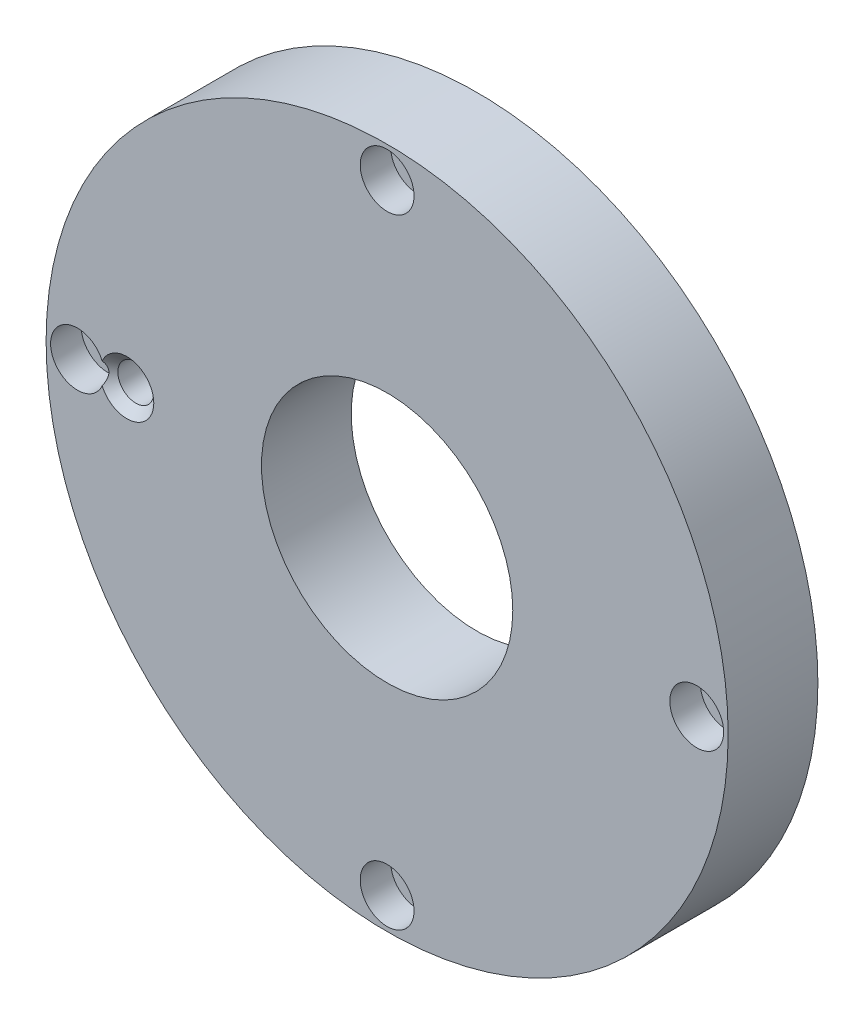
from build123d import *

# Parameters (mm, degrees)
SKETCH_1_R                = 38
SKETCH_1_R_2              = 14
EXTRUDE_1_DEPTH           = 10
HOLE_WIZARD_1_D           = 3.2
HOLE_WIZARD_1_CBORE_D     = 6
HOLE_WIZARD_1_CBORE_DEPTH = 3.4
HOLE_WIZARD_4_0_4_1_D     = 4
CHAMFER_1_SIZE            = 1


with BuildPart() as part:
    # 草图1 → 凸台-拉伸1 (new body)
    with BuildSketch(Plane.XY):
        Circle(SKETCH_1_R)
        Circle(SKETCH_1_R_2, mode=Mode.SUBTRACT)
    extrude(amount=EXTRUDE_1_DEPTH)

    # 打孔尺寸(%根据)内六角圆柱头螺钉的类型1 (through all)
    with Locations(Plane.XY.offset(10)):
        with Locations((0, 34.5), (34.5, 0), (0, -34.5), (-34.5, 0)):
            CounterBoreHole(HOLE_WIZARD_1_D / 2, HOLE_WIZARD_1_CBORE_D / 2, HOLE_WIZARD_1_CBORE_DEPTH)

    # Ø4.0 (4) 直径孔1 (through all)
    with Locations(Plane(origin=(0, 0, 0), x_dir=(-1, 0, 0), z_dir=(0, 0, -1))):
        with Locations((29, 0)):
            Hole(HOLE_WIZARD_4_0_4_1_D / 2)

    # 倒角1
    # the kernel refuses this chamfer: 1 mm, written as the material it takes off along each edge
    with BuildSketch(Plane(origin=(-29, 0, 0), x_dir=(1, 0, 0), z_dir=(0, -1, 0))) as chamfer_1_piece_1:
        Polygon((2 + CHAMFER_1_SIZE, 0), (2, CHAMFER_1_SIZE), (2, 0), align=None)
    revolve(axis=Axis((-29, 0, 0), (0, 0, 1)), mode=Mode.SUBTRACT)
    with BuildSketch(Plane(origin=(-29, 0, 10), x_dir=(1, 0, 0), z_dir=(0, -1, 0))) as chamfer_1_piece_2:
        Polygon((2 + CHAMFER_1_SIZE, 0), (2, -CHAMFER_1_SIZE), (2, 0), align=None)
    revolve(axis=Axis((-29, 0, 10), (0, 0, 1)), mode=Mode.SUBTRACT)


solid = part.part
